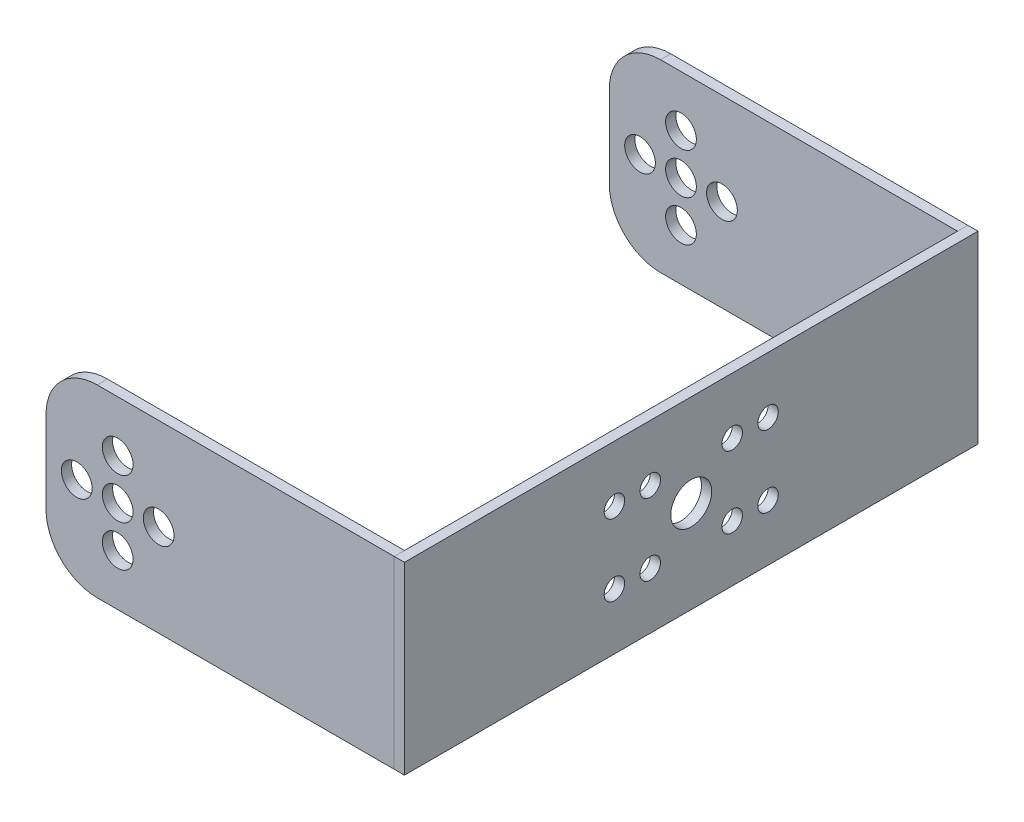
from build123d import *

# Parameters (mm, degrees)
SKETCH2_W           = 34
SKETCH2_H           = 18
BOSS_EXTRUDE1_DEPTH = 1
SKETCH4_W           = 1
SKETCH4_H           = 18
BOSS_EXTRUDE2_DEPTH = 56
SKETCH5_W           = 34
SKETCH5_H           = 18
BOSS_EXTRUDE3_DEPTH = 1
SKETCH6_R           = 1.5
CUT_EXTRUDE1_DEPTH  = 57
FILLET1_R           = 5
FILLET2_R           = 5
SKETCH7_R           = 2
SKETCH7_R_2         = 1
CUT_EXTRUDE2_DEPTH  = 53


with BuildPart() as part:
    # Sketch2 → Boss-Extrude1 (new body)
    with BuildSketch(Plane.XY):
        with Locations((17, 9)):
            Rectangle(SKETCH2_W, SKETCH2_H)
    extrude(amount=BOSS_EXTRUDE1_DEPTH)


with BuildPart() as body_2:
    # Sketch4 → Boss-Extrude2 (new body)
    with BuildSketch(Plane.XY.offset(1)):
        with Locations((34.5, 9)):
            Rectangle(SKETCH4_W, SKETCH4_H)
    extrude(amount=-BOSS_EXTRUDE2_DEPTH)

    # Sketch7 → Cut-Extrude2 (cut)
    with BuildSketch(Plane(origin=(35, 0, 0), x_dir=(0, 0, -1), z_dir=(1, 0, 0))):
        with Locations((27, 9)):
            Circle(SKETCH7_R)
        with Locations((23, 12.5)):
            Circle(SKETCH7_R_2)
        with Locations((23, 5.5)):
            Circle(SKETCH7_R_2)
        with Locations((31, 12.5)):
            Circle(SKETCH7_R_2)
        with Locations((31, 5.5)):
            Circle(SKETCH7_R_2)
        with Locations((19.5, 12.5)):
            Circle(SKETCH7_R_2)
        with Locations((19.5, 5.5)):
            Circle(SKETCH7_R_2)
        with Locations((34.5, 12.5)):
            Circle(SKETCH7_R_2)
        with Locations((34.5, 5.5)):
            Circle(SKETCH7_R_2)
    extrude(amount=-CUT_EXTRUDE2_DEPTH, mode=Mode.SUBTRACT)


with BuildPart() as body_3:
    # Sketch5 → Boss-Extrude3 (new body)
    with BuildSketch(Plane(origin=(0, 0, -55), x_dir=(-1, 0, 0), z_dir=(0, 0, -1))):
        with Locations((-17, 9)):
            Rectangle(SKETCH5_W, SKETCH5_H)
    extrude(amount=-BOSS_EXTRUDE3_DEPTH)


with BuildPart() as cut_extrude1_tool:
    # Sketch6 → Cut-Extrude1 (new body)
    with BuildSketch(Plane(origin=(0, 0, -55), x_dir=(-1, 0, 0), z_dir=(0, 0, -1))):
        with Locations((-3, 9)):
            Circle(SKETCH6_R)
        with Locations((-7, 9)):
            Circle(SKETCH6_R)
        with Locations((-7, 13)):
            Circle(SKETCH6_R)
        with Locations((-7, 5)):
            Circle(SKETCH6_R)
        with Locations((-11, 9)):
            Circle(SKETCH6_R)
    extrude(amount=-CUT_EXTRUDE1_DEPTH)


with BuildPart() as part_1:
    add(part.part)

    # Cut-Extrude1: cut by cut_extrude1_tool
    add(cut_extrude1_tool.part, mode=Mode.SUBTRACT)

    # Fillet2
    fillet2_edges = [part_1.edges().sort_by_distance(p)[0] for p in [
        (0, 0, 0.5),
        (0, 18, 0.5),
    ]]
    fillet(fillet2_edges, radius=FILLET2_R)


with BuildPart() as body_3_1:
    add(body_3.part)

    # Cut-Extrude1: cut by cut_extrude1_tool
    add(cut_extrude1_tool.part, mode=Mode.SUBTRACT)

    # Fillet1
    fillet1_edges = [body_3_1.edges().sort_by_distance(p)[0] for p in [
        (0, 0, -54.5),
        (0, 18, -54.5),
    ]]
    fillet(fillet1_edges, radius=FILLET1_R)


solid = Compound([body_2.part, part_1.part, body_3_1.part])
